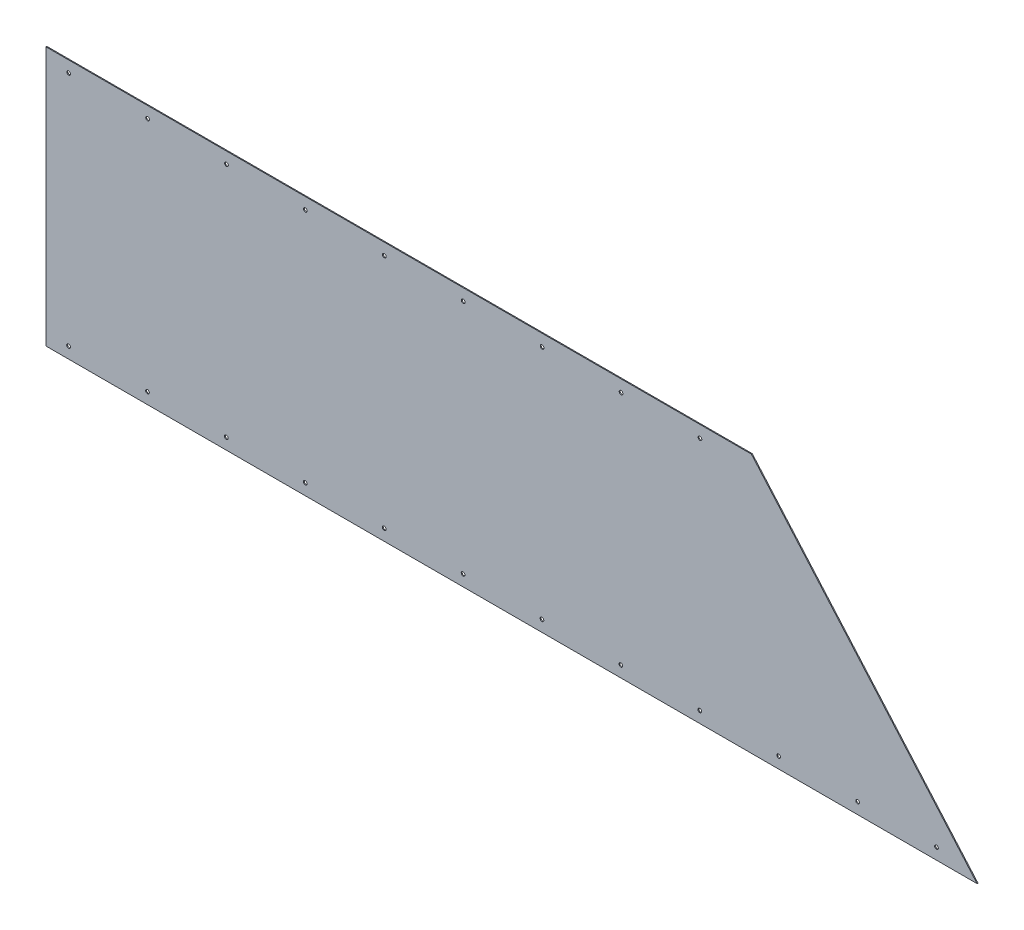
from build123d import *

# Parameters (mm, degrees)
BRIDA_BASE1_DEPTH            = 1.5875
TALADRO_DE_MARGEN_PARA_M62_D = 6.6


# Sheet-metal steps are written as plain solids
with BuildPart() as part:
    # Croquis1 → Brida base1 (new body)
    with BuildSketch(Plane.XY):
        Polygon((424.28, 230.125), (824.78, -229.645), (-827.22, -229.645), (-827.22, 230.125), align=None)
    extrude(amount=-BRIDA_BASE1_DEPTH)

    # Taladro de margen para M62 (through all)
    with Locations(Plane(origin=(0, 0, -1.5875), x_dir=(-1, 0, 0), z_dir=(0, 0, -1))):
        with Locations((787.22, -209.645), (647.22, -209.645), (507.22, -209.645), (367.22, -209.645), (227.22, -209.645), (87.22, -209.645), (-52.78, -209.645), (-192.78, -209.645), (-332.78, -209.645), (-472.78, -209.645), (-612.78, -209.645), (-752.78, -209.645), (-753.017315716, 208.330699563), (-613.017405979, 208.489676218), (-473.017496241, 208.648652874), (-333.017586504, 208.80762953), (-193.017676767, 208.966606186), (-53.01776703, 209.125582842), (86.982142707, 209.284559498), (226.982052445, 209.443536154), (366.981962182, 209.60251281), (506.981871919, 209.761489466), (646.981781656, 209.920466122), (786.981691393, 210.079442778)):
            Hole(TALADRO_DE_MARGEN_PARA_M62_D / 2)


solid = part.part
